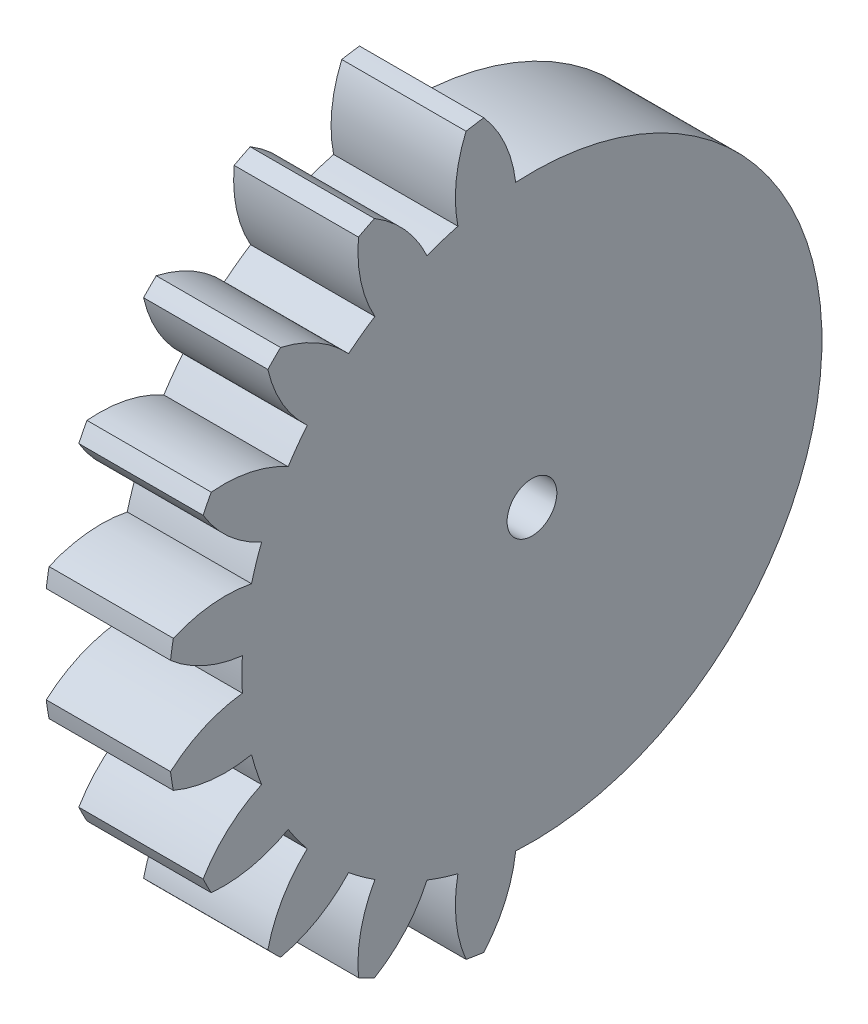
from build123d import *

# Parameters (mm, degrees)
BASPROSKE_W        = 15
BASPROSKE_H        = 44
TOOTHCUT_DEPTH     = 65.007812023
TEETHCUTS_DEPTH    = 15
BORSKE_R           = 3
BORE_DEPTH         = 50.0000508
CUT_EXTRUDE1_REACH = 65.743


# Read off the part's stored shape, not the designer's step: TeethCuts
with BuildPart() as part:
    # BasProSke → Base-Revolve (revolve)
    with BuildSketch(Plane(origin=(0, 0, 0), x_dir=(1, 0, 0), z_dir=(0, 1, 0)), mode=Mode.PRIVATE) as base_revolve_sk:
        with Locations((7.5, 22)):
            Rectangle(BASPROSKE_W, BASPROSKE_H)
    revolve(base_revolve_sk.sketch.rotate(Axis((-10, 0, 0), (1, 0, 0)), 180), axis=Axis((-10, 0, 0), (1, 0, 0)))

    # TooCutSke → ToothCut (cut, through all)
    with BuildSketch(Plane(origin=(0, 0, 0), x_dir=(0, 0, -1), z_dir=(1, 0, 0))):
        with BuildLine():
            ThreePointArc((1.961730392, 34.943978235), (0, 34.999), (-1.961730392, 34.943978235))
            ThreePointArc((-1.961730392, 34.943978235), (-3.235659864, 39.585086827), (-5.832115241, 43.637395396))
            ThreePointArc((-5.832115241, 43.637395396), (0, 44.0254), (5.832115241, 43.637395396))
            ThreePointArc((5.832115241, 43.637395396), (3.235659864, 39.585086827), (1.961730392, 34.943978235))
        make_face()
    extrude(amount=TOOTHCUT_DEPTH, mode=Mode.SUBTRACT)

    # TeethCuts outline → TeethCuts (cut)
    with BuildSketch(Plane.YZ):
        with BuildLine():
            ThreePointArc((39.683804298, 19.005148682), (36.636439054, 15.299557845), (32.627490176, 12.663999598))
            ThreePointArc((32.627490176, 12.663999598), (33.286027014, 10.815285786), (33.839906235, 8.932566653))
            ThreePointArc((33.839906235, 8.932566653), (38.632356276, 9.156756269), (43.275818192, 7.950066657))
            ThreePointArc((43.275818192, 7.950066657), (41.846486717, 13.596747753), (39.683804298, 19.005148682))
        make_face()
        with BuildLine():
            ThreePointArc((-34.943978235, 1.961730392), (-39.571147477, 3.229461904), (-43.614454593, 5.812000568))
            ThreePointArc((-43.614454593, 5.812000568), (-44, 0), (-43.614454592, -5.812000568))
            ThreePointArc((-43.614454592, -5.812000568), (-39.571147477, -3.229461904), (-34.943978235, -1.961730392))
            ThreePointArc((-34.943978235, -1.961730392), (-34.999, 0), (-34.943978235, 1.961730392))
        make_face()
        with BuildLine():
            ThreePointArc((-32.627490176, 12.663999598), (-36.636439054, 15.299557845), (-39.683804298, 19.005148682))
            ThreePointArc((-39.683804298, 19.005148682), (-41.846486717, 13.596747753), (-43.275818192, 7.950066657))
            ThreePointArc((-43.275818192, 7.950066657), (-38.632356276, 9.156756269), (-33.839906235, 8.932566653))
            ThreePointArc((-33.839906235, 8.932566653), (-33.286027014, 10.815285786), (-32.627490176, 12.663999598))
        make_face()
        with BuildLine():
            ThreePointArc((-27.117196049, 22.126628289), (-30.115500715, 25.872026467), (-31.868626746, 30.337940427))
            ThreePointArc((-31.868626746, 30.337940427), (-35.596747753, 25.862551101), (-38.701043186, 20.933925966))
            ThreePointArc((-38.701043186, 20.933925966), (-33.911960876, 20.64664734), (-29.423348436, 18.952481837))
            ThreePointArc((-29.423348436, 18.952481837), (-28.314785786, 20.571896045), (-27.117196049, 22.126628289))
        make_face()
        with BuildLine():
            ThreePointArc((-18.952481837, 29.423348436), (-20.64664734, 33.911960876), (-20.933925966, 38.701043186))
            ThreePointArc((-20.933925966, 38.701043186), (-25.862551101, 35.596747753), (-30.337940427, 31.868626746))
            ThreePointArc((-30.337940427, 31.868626746), (-25.872026467, 30.115500715), (-22.126628289, 27.117196049))
            ThreePointArc((-22.126628289, 27.117196049), (-20.571896045, 28.314785786), (-18.952481837, 29.423348436))
        make_face()
        with BuildLine():
            ThreePointArc((-8.932566653, 33.839906235), (-9.156756269, 38.632356276), (-7.950066657, 43.275818192))
            ThreePointArc((-7.950066657, 43.275818192), (-13.596747753, 41.846486717), (-19.005148682, 39.683804298))
            ThreePointArc((-19.005148682, 39.683804298), (-15.299557845, 36.636439054), (-12.663999598, 32.627490176))
            ThreePointArc((-12.663999598, 32.627490176), (-10.815285786, 33.286027014), (-8.932566653, 33.839906235))
        make_face()
        with BuildLine():
            ThreePointArc((1.961730392, 34.943978235), (3.229461904, 39.571147477), (5.812000568, 43.614454593))
            ThreePointArc((5.812000568, 43.614454593), (0, 44), (-5.812000568, 43.614454593))
            ThreePointArc((-5.812000568, 43.614454593), (-3.229461904, 39.571147477), (-1.961730392, 34.943978235))
            ThreePointArc((-1.961730392, 34.943978235), (0, 34.999), (1.961730392, 34.943978235))
        make_face()
        with BuildLine():
            ThreePointArc((12.663999598, 32.627490176), (15.299557845, 36.636439054), (19.005148682, 39.683804298))
            ThreePointArc((19.005148682, 39.683804298), (13.596747753, 41.846486717), (7.950066657, 43.275818192))
            ThreePointArc((7.950066657, 43.275818192), (9.156756269, 38.632356276), (8.932566653, 33.839906235))
            ThreePointArc((8.932566653, 33.839906235), (10.815285786, 33.286027014), (12.663999598, 32.627490176))
        make_face()
        with BuildLine():
            ThreePointArc((22.126628289, 27.117196049), (25.872026467, 30.115500715), (30.337940427, 31.868626746))
            ThreePointArc((30.337940427, 31.868626746), (25.862551101, 35.596747753), (20.933925966, 38.701043186))
            ThreePointArc((20.933925966, 38.701043186), (20.64664734, 33.911960876), (18.952481837, 29.423348436))
            ThreePointArc((18.952481837, 29.423348436), (20.571896045, 28.314785786), (22.126628289, 27.117196049))
        make_face()
        with BuildLine():
            ThreePointArc((29.423348436, 18.952481837), (33.911960876, 20.64664734), (38.701043186, 20.933925966))
            ThreePointArc((38.701043186, 20.933925966), (35.596747753, 25.862551101), (31.868626746, 30.337940427))
            ThreePointArc((31.868626746, 30.337940427), (30.115500715, 25.872026467), (27.117196049, 22.126628289))
            ThreePointArc((27.117196049, 22.126628289), (28.314785786, 20.571896045), (29.423348436, 18.952481837))
        make_face()
    extrude(amount=TEETHCUTS_DEPTH, mode=Mode.SUBTRACT)

    # BorSke → Bore (cut, symmetric)
    with BuildSketch(Plane(origin=(0, 0, 0), x_dir=(0, 0, -1), z_dir=(1, 0, 0))):
        with Locations(Location((0, 0, 0), (0, 0, 180))):
            Circle(BORSKE_R)
    extrude(amount=BORE_DEPTH, both=True, mode=Mode.SUBTRACT)

    # Sketch2 → Cut-Extrude1 (cut, up to next)
    with BuildSketch(Plane(origin=(15, 0, 0), x_dir=(0, 0, -1), z_dir=(1, 0, 0)), mode=Mode.PRIVATE) as cut_extrude1_sk1:
        with BuildLine():
            Line((1.961730392, -34.943978235), (2.123495302, -44.219744966))
            ThreePointArc((2.123495302, -44.219744966), (44.2706282, 0.080968685), (1.961730392, 44.227216632))
            Line((1.961730392, 44.227216632), (1.961730392, 34.943978235))
            ThreePointArc((1.961730392, 34.943978235), (34.999, 0), (1.961730392, -34.943978235))
        make_face()
    cut_extrude1_tool1 = extrude(cut_extrude1_sk1.sketch, amount=-CUT_EXTRUDE1_REACH, mode=Mode.PRIVATE) & part.part
    add(cut_extrude1_tool1.solids().sort_by_distance((15, 39.585597, -2.942185))[0], mode=Mode.SUBTRACT)


solid = part.part
